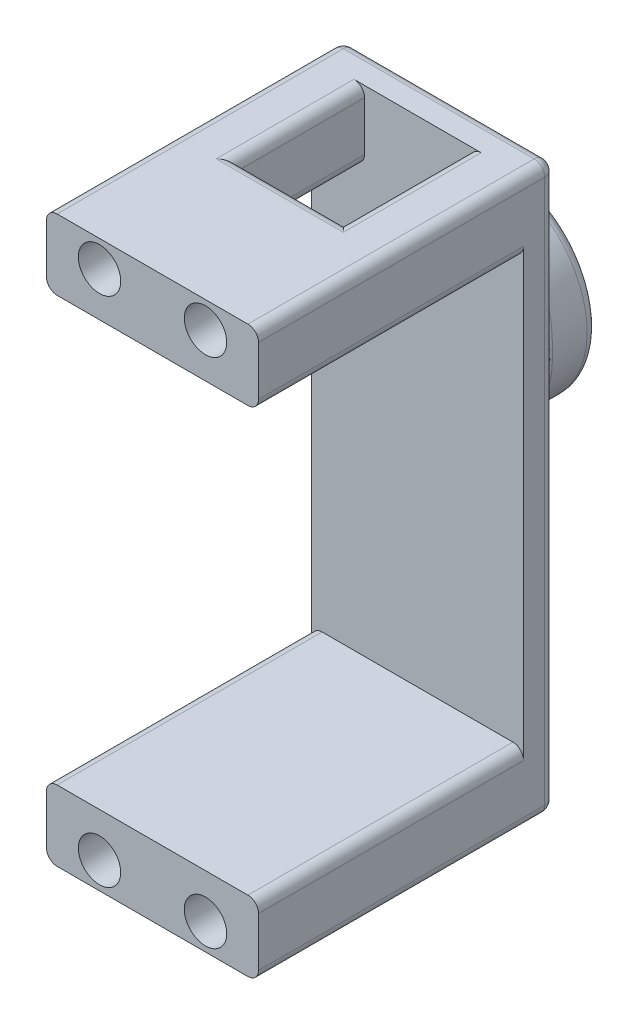
from build123d import *

# Parameters (mm, degrees)
SKETCH1_W           = 20
SKETCH1_H           = 53.3
BOSS_EXTRUDE1_DEPTH = 3
SKETCH1_3_W         = 20
SKETCH1_3_H         = 6.65
BOSS_EXTRUDE2_DEPTH = 25
SKETCH3_R           = 2
CUT_EXTRUDE1_DEPTH  = 5
BOSS_EXTRUDE3_DEPTH = 5
CUT_EXTRUDE2_REACH  = 64.176
SKETCH6_W           = 10
SKETCH6_H           = 12
FILLET2_R           = 1
FILLET3_R           = 1


with BuildPart() as part:
    # Sketch1 → Boss-Extrude1 (new body)
    with BuildSketch(Plane.XY):
        with Locations((10, -20)):
            Rectangle(SKETCH1_W, SKETCH1_H)
    extrude(amount=-BOSS_EXTRUDE1_DEPTH)

    # Sketch1<3> → Boss-Extrude2 (add)
    with BuildSketch(Plane.XY):
        with Locations((10, 3.325)):
            Rectangle(SKETCH1_3_W, SKETCH1_3_H)
        with Locations((10, -43.325)):
            Rectangle(SKETCH1_3_W, SKETCH1_3_H)
    extrude(amount=BOSS_EXTRUDE2_DEPTH)

    # Sketch3 → Cut-Extrude1 (cut)
    with BuildSketch(Plane.XY.offset(25)):
        with Locations((5, 4.15)):
            Circle(SKETCH3_R)
        with Locations((15, 4.15)):
            Circle(SKETCH3_R)
        with Locations((15, -44.15)):
            Circle(SKETCH3_R)
        with Locations((5, -44.15)):
            Circle(SKETCH3_R)
    extrude(amount=-CUT_EXTRUDE1_DEPTH, mode=Mode.SUBTRACT)

    # Sketch4 → Boss-Extrude3 (add)
    with BuildSketch(Plane(origin=(0, 0, -3), x_dir=(-1, 0, 0), z_dir=(0, 0, -1))):
        with BuildLine():
            ThreePointArc((-10, -19), (-3.636039, -16.363961), (-1, -10))
            ThreePointArc((-1, -10), (-16.363961, -3.636039), (-10, -19))
        make_face()
    extrude(amount=BOSS_EXTRUDE3_DEPTH)

    # Sketch5 → Cut-Revolve1 (revolve, cut)
    with BuildSketch(Plane(origin=(10, 0, 0), x_dir=(0, 0, -1), z_dir=(1, 0, 0))):
        with BuildLine():
            Line((5, -10), (8, -10))
            Line((8, -10), (8, -4))
            ThreePointArc((8, -4), (5.791796, -6.645898), (5, -10))
        make_face()
    revolve(axis=Axis((10, -10, -8), (0, 0, 1)), mode=Mode.SUBTRACT)

    # Sketch6 → Cut-Extrude2 (cut, up to next)
    with BuildSketch(Plane(origin=(0, 6.65, 0), x_dir=(1, 0, 0), z_dir=(0, 1, 0)), mode=Mode.PRIVATE) as cut_extrude2_sk1:
        with Locations((10, -6)):
            Rectangle(SKETCH6_W, SKETCH6_H)
    cut_extrude2_tool1 = extrude(cut_extrude2_sk1.sketch, amount=-CUT_EXTRUDE2_REACH, mode=Mode.PRIVATE) & part.part
    add(cut_extrude2_tool1.solids().sort_by_distance((10, 6.65, 6))[0], mode=Mode.SUBTRACT)

    # Fillet2
    fillet2_edges = [part.edges().sort_by_distance(p)[0] for p in [
        (10, -46.65, -3),
        (10, 6.65, -3),
        (10, -1, -8),
        (0, -20, -3),
        (20, -20, -3),
        (10, 6.65, 12),
        (5, 6.65, 6),
        (15, 6.65, 6),
        (15, 0, 6),
        (10, 0, 12),
        (5, 0, 6),
        (20, 6.65, 11),
        (20, 0, 12.5),
        (20, -40, 12.5),
        (20, -46.65, 11),
        (0, -46.65, 11),
        (0, -40, 12.5),
        (0, 0, 12.5),
        (0, 6.65, 11),
    ]]
    fillet(fillet2_edges, radius=FILLET2_R)

    # Fillet3
    fillet3_edges = [part.edges().sort_by_distance(p)[0] for p in [
        (10, -1, -3),
        (10, -1, -3),
    ]]
    fillet(fillet3_edges, radius=FILLET3_R)


solid = part.part
